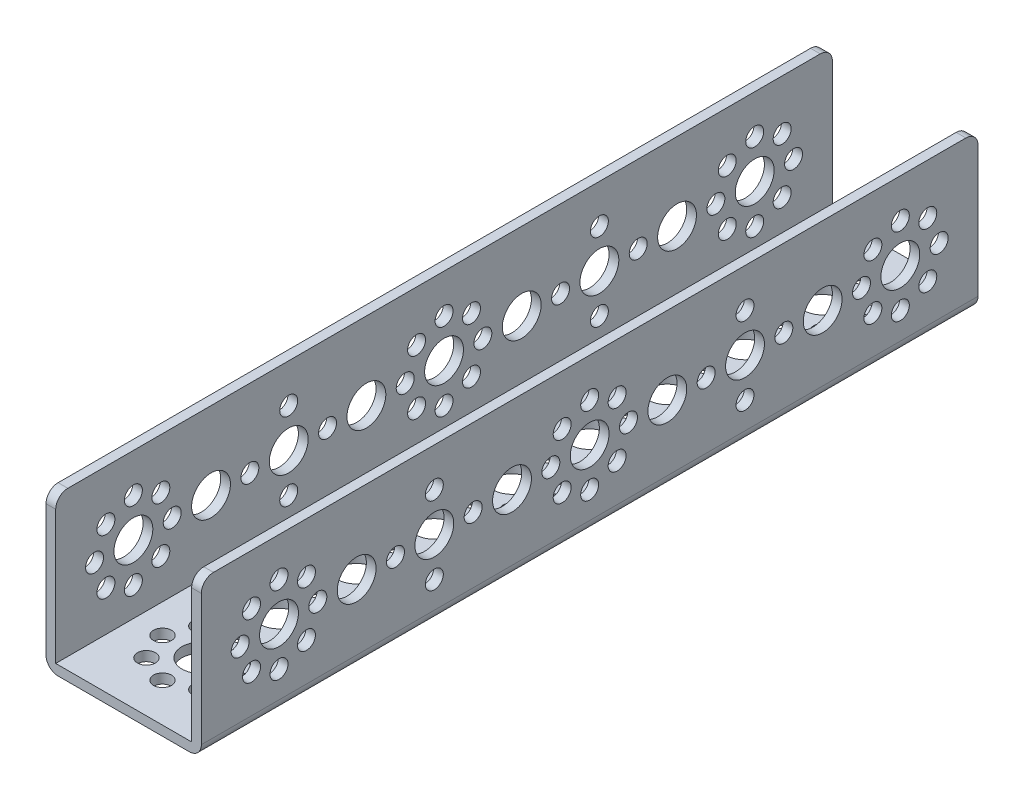
from build123d import *

# Parameters (mm, degrees)
SKETCH1_W                      = 160
SKETCH1_H                      = 32
BOSS_EXTRUDE1_DEPTH            = 32
SKETCH2_W                      = 28
SKETCH2_H                      = 30
CUT_EXTRUDE1_DEPTH             = 164.951212255
F_8_0_8_DIAMETER_HOLE1_D       = 8
F_8_0_8_DIAMETER_HOLE1_DEPTH   = 2
F_3_7_3_7_DIAMETER_HOLE1_D     = 3.7
F_3_7_3_7_DIAMETER_HOLE1_DEPTH = 2
F_3_7_3_7_DIAMETER_HOLE2_D     = 3.7
F_3_7_3_7_DIAMETER_HOLE2_DEPTH = 32
F_8_0_8_DIAMETER_HOLE2_D       = 8
F_8_0_8_DIAMETER_HOLE2_DEPTH   = 32
F_8_0_8_DIAMETER_HOLE3_D       = 8
F_8_0_8_DIAMETER_HOLE4_D       = 8
F_8_0_8_DIAMETER_HOLE4_DEPTH   = 32
F_3_7_3_7_DIAMETER_HOLE3_D     = 3.7
F_3_7_3_7_DIAMETER_HOLE3_DEPTH = 32
FILLET1_R                      = 2.5


with BuildPart() as part:
    # Sketch1 → Boss-Extrude1 (new body)
    with BuildSketch(Plane(origin=(16, 0, 0), x_dir=(0, 0, -1), z_dir=(1, 0, 0))):
        with Locations((64, 16)):
            Rectangle(SKETCH1_W, SKETCH1_H)
    extrude(amount=-BOSS_EXTRUDE1_DEPTH)

    # Sketch2 → Cut-Extrude1 (cut, through all)
    with BuildSketch(Plane(origin=(0, 0, -144), x_dir=(-1, 0, 0), z_dir=(0, 0, -1))):
        with Locations((0, 17)):
            Rectangle(SKETCH2_W, SKETCH2_H)
    extrude(amount=-CUT_EXTRUDE1_DEPTH, mode=Mode.SUBTRACT)

    # Ø8.0 (8) Diameter Hole1
    with Locations(Plane.ZY.offset(16)):
        with Locations((-64, 16), (-128, 16), (-32, 16), (-96, 16), (-16, 16), (-48, 16), (-80, 16), (-112, 16), (0, 16)):
            Hole(F_8_0_8_DIAMETER_HOLE1_D / 2, depth=F_8_0_8_DIAMETER_HOLE1_DEPTH)

    # Ø3.7 (3.7) Diameter Hole1
    with Locations(Plane.ZY.offset(16)):
        with Locations((0, 24), (0, 8), (-8, 16), (8, 16), (-5.656854249, 21.656854249), (5.656854249, 21.656854249), (5.656854249, 10.343145751), (-5.656854249, 10.343145751), (-64, 24), (-64, 8), (-72, 16), (-56, 16), (-69.656854249, 21.656854249), (-58.343145751, 21.656854249), (-58.343145751, 10.343145751), (-69.656854249, 10.343145751), (-128, 24), (-128, 8), (-136, 16), (-120, 16), (-133.656854249, 21.656854249), (-122.34314575, 21.656854249), (-122.34314575, 10.343145751), (-133.656854249, 10.343145751), (-32, 24), (-40, 16), (-32, 8), (-24, 16), (-96, 24), (-104, 16), (-96, 8), (-88, 16)):
            Hole(F_3_7_3_7_DIAMETER_HOLE1_D / 2, depth=F_3_7_3_7_DIAMETER_HOLE1_DEPTH)

    # Ø3.7 (3.7) Diameter Hole2
    with Locations(Plane(origin=(0, 0, 0), x_dir=(-1, 0, 0), z_dir=(0, -1, 0))):
        with Locations((8, 0), (5.656854249, 5.656854249), (0, 8), (-5.656854249, 5.656854249), (-8, 0), (-5.656854249, -5.656854249), (0, -8), (5.656854249, -5.656854249), (8, 64), (5.656854249, 69.656854249), (0, 72), (-5.656854249, 69.656854249), (-8, 64), (-5.656854249, 58.343145751), (0, 56), (5.656854249, 58.343145751), (8, 128), (5.656854249, 133.656854249), (0, 136), (-5.656854249, 133.656854249), (-8, 128), (-5.656854249, 122.34314575), (0, 120), (5.656854249, 122.34314575), (8, 32), (0, 40), (-8, 32), (0, 24), (8, 96), (0, 104), (-8, 96), (0, 88)):
            Hole(F_3_7_3_7_DIAMETER_HOLE2_D / 2, depth=F_3_7_3_7_DIAMETER_HOLE2_DEPTH)

    # Ø8.0 (8) Diameter Hole2
    with Locations(Plane(origin=(0, 0, 0), x_dir=(-1, 0, 0), z_dir=(0, -1, 0))):
        with Locations((0, 0), (0, 64), (0, 128), (0, 32), (0, 96), (0, 16), (0, 48), (0, 80), (0, 112)):
            Hole(F_8_0_8_DIAMETER_HOLE2_D / 2, depth=F_8_0_8_DIAMETER_HOLE2_DEPTH)

    # Ø8.0 (8) Diameter Hole3 (through all)
    with Locations(Plane.ZY.offset(-14)):
        with Locations((-32, 16)):
            Hole(F_8_0_8_DIAMETER_HOLE3_D / 2)

    # Ø8.0 (8) Diameter Hole4
    with Locations(Plane(origin=(16, 0, 0), x_dir=(0, 0, -1), z_dir=(1, 0, 0))):
        with Locations((64, 16), (128, 16), (96, 16), (16, 16), (48, 16), (80, 16), (112, 16), (0, 16)):
            Hole(F_8_0_8_DIAMETER_HOLE4_D / 2, depth=F_8_0_8_DIAMETER_HOLE4_DEPTH)

    # Ø3.7 (3.7) Diameter Hole3
    with Locations(Plane(origin=(16, 0, 0), x_dir=(0, 0, -1), z_dir=(1, 0, 0))):
        with Locations((0, 24), (0, 8), (8, 16), (-8, 16), (5.656854249, 21.656854249), (-5.656854249, 21.656854249), (-5.656854249, 10.343145751), (5.656854249, 10.343145751), (64, 24), (64, 8), (72, 16), (56, 16), (69.656854249, 21.656854249), (58.343145751, 21.656854249), (58.343145751, 10.343145751), (69.656854249, 10.343145751), (128, 24), (128, 8), (136, 16), (120, 16), (133.656854249, 21.656854249), (122.34314575, 21.656854249), (122.34314575, 10.343145751), (133.656854249, 10.343145751), (32, 24), (40, 16), (32, 8), (24, 16), (96, 24), (104, 16), (96, 8), (88, 16)):
            Hole(F_3_7_3_7_DIAMETER_HOLE3_D / 2, depth=F_3_7_3_7_DIAMETER_HOLE3_DEPTH)

    # Fillet1
    fillet1_edges = [part.edges().sort_by_distance(p)[0] for p in [
        (-16, 0, -64),
        (-15, 32, -144),
        (-15, 32, 16),
        (16, 0, -64),
        (15, 32, 16),
        (15, 32, -144),
    ]]
    fillet(fillet1_edges, radius=FILLET1_R)


solid = part.part
